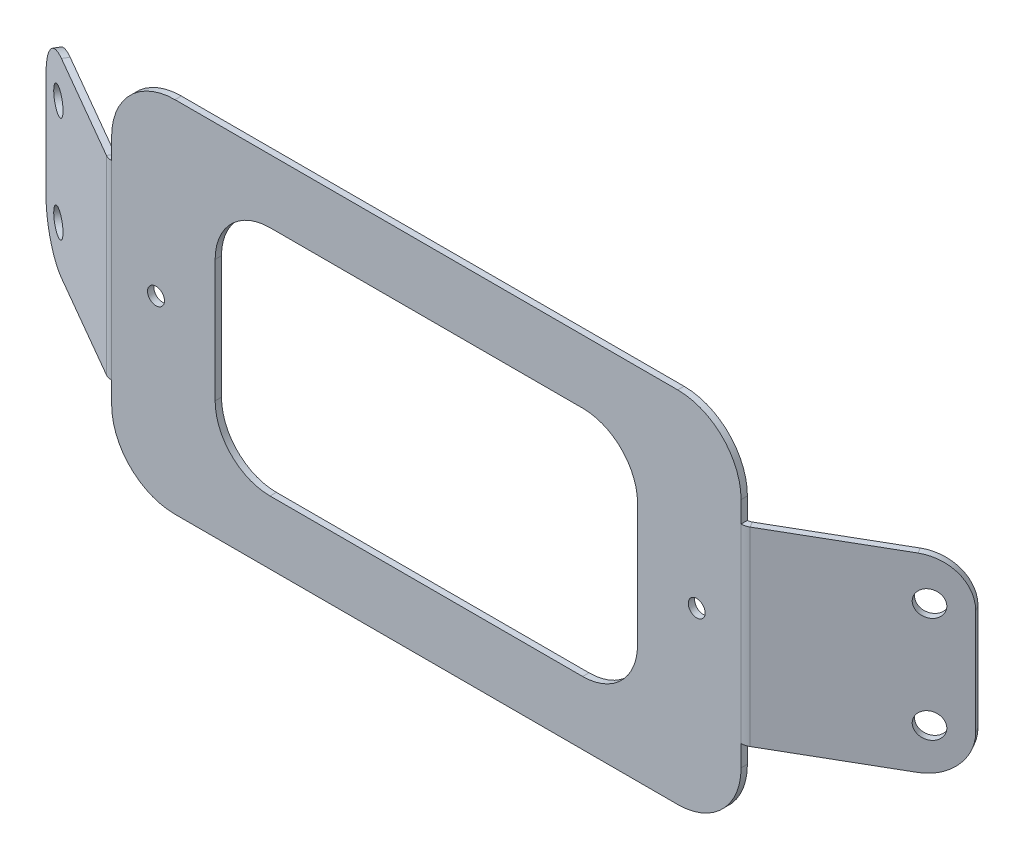
from build123d import *

# Parameters (mm, degrees)
BASE_FLANGE1_DEPTH          = 1.5
SM_EDGE_FLANGE_1_DEPTH      = 45
SM_EDGE_FLANGE_1_BEND_DEPTH = 45
SKETCH12_R                  = 3
CUT_EXTRUDE1_DEPTH          = 10
FILLET1_R                   = 10
SKETCH13_R                  = 3
CUT_EXTRUDE2_DEPTH          = 10
SKETCH14_R                  = 2
CUT_EXTRUDE3_DEPTH          = 10


# Sheet-metal steps are written as plain solids
with BuildPart() as part:
    # Sketch1 → Base-Flange1 (new body)
    with BuildSketch(Plane.XY):
        with BuildLine():
            Line((15, 0), (134, 0))
            ThreePointArc((134, 0), (144.606601718, 4.393398282), (149, 15))
            Line((149, 15), (149, 70))
            ThreePointArc((149, 70), (144.606601718, 80.606601718), (134, 85))
            Line((134, 85), (15, 85))
            ThreePointArc((15, 85), (4.393398282, 80.606601718), (0, 70))
            Line((0, 70), (0, 15))
            ThreePointArc((0, 15), (4.393398282, 4.393398282), (15, 0))
        make_face()
        with BuildLine():
            Line((111.5, 15), (37.5, 15))
            ThreePointArc((37.5, 15), (28.307611845, 18.807611845), (24.5, 28))
            Line((24.5, 28), (24.5, 57))
            ThreePointArc((24.5, 57), (28.307611845, 66.192388155), (37.5, 70))
            Line((37.5, 70), (111.5, 70))
            ThreePointArc((111.5, 70), (120.692388155, 66.192388155), (124.5, 57))
            Line((124.5, 57), (124.5, 28))
            ThreePointArc((124.5, 28), (120.692388155, 18.807611845), (111.5, 15))
        make_face(mode=Mode.SUBTRACT)
    extrude(amount=-BASE_FLANGE1_DEPTH)

    # Ребро-кромка1 section (across the edge) → Ребро-кромка1 (add)
    with BuildSketch(Plane(origin=(-0.495706006, 20, -1.5), x_dir=(0.49999999999999495, 0, -0.8660254037844416), z_dir=(0, 1, 0))):
        with BuildLine():
            Line((-1.5, 0.495706006), (-1.5, 39.598076211))
            Line((-1.5, 39.598076211), (0, 39.598076211))
            Line((0, 39.598076211), (0, 0.495706006))
            ThreePointArc((0, 0.495706006), (0.063037221, 0.016890773), (0.247853003, -0.429293994))
            Line((0.247853003, -0.429293994), (-1.051185103, -1.179293994))
            ThreePointArc((-1.051185103, -1.179293994), (-1.385851518, -0.371337795), (-1.5, 0.495706006))
        make_face()
    extrude(amount=SM_EDGE_FLANGE_1_DEPTH)

    # Ребро-кромка1 section 2 (across the edge) → Ребро-кромка1 bend (add)
    with BuildSketch(Plane(origin=(149.495706006, 65, -1.5), x_dir=(-0.49999999999999495, 0, -0.8660254037844416), z_dir=(0, -1, 0))):
        with BuildLine():
            Line((-1.5, 0.495706006), (-1.5, 39.598076211))
            Line((-1.5, 39.598076211), (0, 39.598076211))
            Line((0, 39.598076211), (0, 0.495706006))
            ThreePointArc((0, 0.495706006), (0.063037221, 0.016890773), (0.247853003, -0.429293994))
            Line((0.247853003, -0.429293994), (-1.051185103, -1.179293994))
            ThreePointArc((-1.051185103, -1.179293994), (-1.385851518, -0.371337795), (-1.5, 0.495706006))
        make_face()
    extrude(amount=SM_EDGE_FLANGE_1_BEND_DEPTH)

    # Sketch12 → Cut-Extrude1 (cut)
    with BuildSketch(Plane(origin=(37.474407449, 0, 64.907577685), x_dir=(0.8660254037844416, 0, -0.49999999999999517), z_dir=(0.49999999999999517, 0, 0.8660254037844416))):
        with Locations((161.815155369, 30)):
            Circle(SKETCH12_R)
        with Locations((161.815155369, 55)):
            Circle(SKETCH12_R)
    extrude(amount=-CUT_EXTRUDE1_DEPTH, mode=Mode.SUBTRACT)

    # Fillet1
    fillet1_edges = [part.edges().sort_by_distance(p)[0] for p in [
        (-35.163645946, 20, -20.649519053),
        (-35.163645946, 65, -20.649519053),
        (184.163645946, 65, -20.649519053),
        (184.163645946, 20, -20.649519053),
    ]]
    fillet(fillet1_edges, radius=FILLET1_R)

    # Sketch13 → Cut-Extrude2 (cut)
    with BuildSketch(Plane(origin=(-0.224407449, 0, 0.388685103), x_dir=(0.8660254037844416, 0, 0.49999999999999517), z_dir=(-0.49999999999999517, 0, 0.8660254037844416))):
        with Locations((-32.777370205, 30)):
            Circle(SKETCH13_R)
        with Locations((-32.777370205, 55)):
            Circle(SKETCH13_R)
    extrude(amount=-CUT_EXTRUDE2_DEPTH, mode=Mode.SUBTRACT)

    # Sketch14 → Cut-Extrude3 (cut)
    with BuildSketch(Plane(origin=(0, 0, -1.5), x_dir=(-1, 0, 0), z_dir=(0, 0, -1))):
        with Locations((-138.5, 42.5)):
            Circle(SKETCH14_R)
        with Locations((-10.5, 42.5)):
            Circle(SKETCH14_R)
    extrude(amount=-CUT_EXTRUDE3_DEPTH, mode=Mode.SUBTRACT)


solid = part.part
